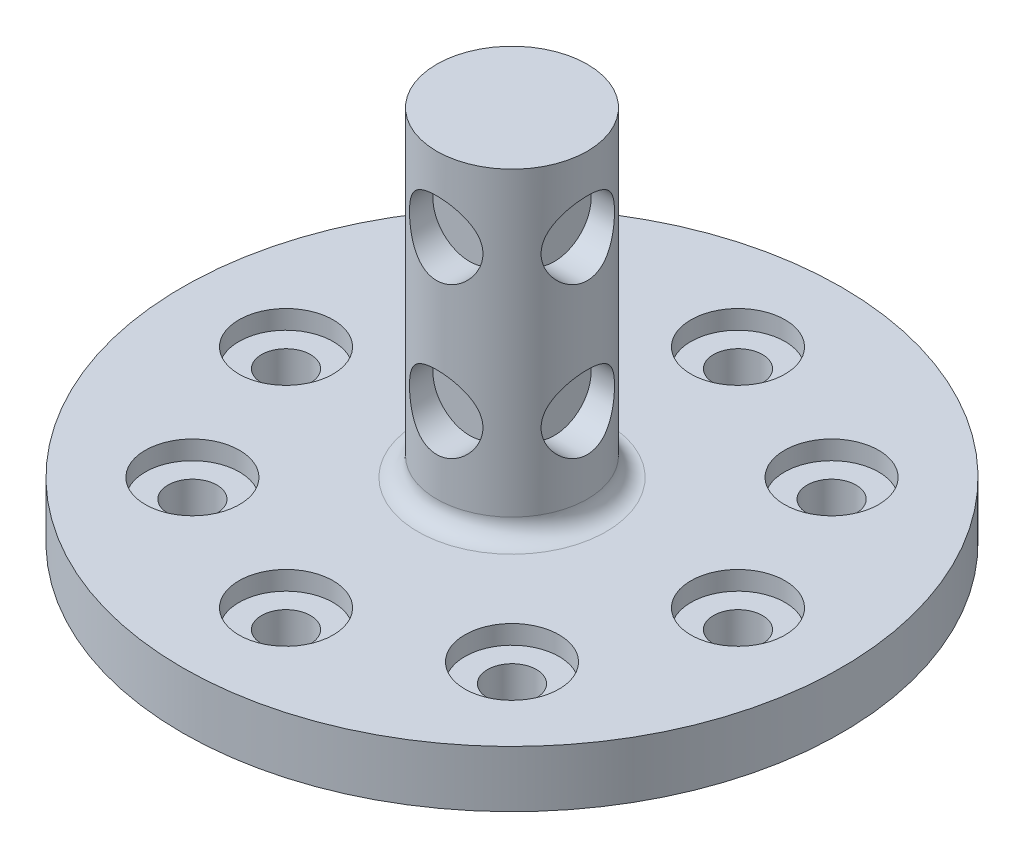
from build123d import *

# Parameters (mm, degrees)
SKETCH_1_R               = 4
EXTRUDE_1_DEPTH          = 16
SKETCH_2_R               = 1.95
CUT_EXTRUDE_1_DEPTH      = 17.970562748
PATTERN_CIRCULAR_1_COUNT = 4
SKETCH_3_W               = 4.5
SKETCH_3_H               = 4.5
EXTRUDE_3_DEPTH          = 16
EXTRUDE_START            = 1
SKETCH_5_R               = 4
EXTRUDE_5_DEPTH          = 1
SKETCH_6_R               = 17.5
EXTRUDE_6_DEPTH          = 3
SKETCH_7_R               = 7.5
CUT_EXTRUDE_2_DEPTH      = 1.8
FILLET_1_R               = 1
SKETCH_8_R               = 1.3
CUT_EXTRUDE_3_DEPTH      = 31.024989649
SKETCH_9_R               = 2.5
SKETCH_9_R_2             = 1.3
CUT_EXTRUDE_4_DEPTH      = 1
PATTERN_CIRCULAR_2_COUNT = 8


with BuildPart() as part:
    # 草图1 → 凸台-拉伸1 (new body)
    with BuildSketch(Plane(origin=(0, 0, 0), x_dir=(1, 0, 0), z_dir=(0, 1, 0))):
        with Locations(Location((0, 0, 0), (0, 0, 270))):
            Circle(SKETCH_1_R)
    extrude(amount=EXTRUDE_1_DEPTH)

    # 草图2 → 切除-拉伸1 (cut, symmetric)
    with BuildSketch(Plane.XY):
        with Locations(Location((0, 12, 0), (0, 0, 90.000000018))):
            Circle(SKETCH_2_R)
        with Locations(Location((0, 4, 0), (0, 0, 90.000000018))):
            Circle(SKETCH_2_R)
    cut_extrude_1 = extrude(amount=CUT_EXTRUDE_1_DEPTH, both=True, mode=Mode.SUBTRACT)

    # 阵列(圆周)1: 切除-拉伸1 ×4 about axis
    pattern_circular_1_axis = Axis((0, 16, 0), (0, 1, 0))
    for i in range(1, PATTERN_CIRCULAR_1_COUNT):
        add(cut_extrude_1.rotate(pattern_circular_1_axis, i * 360 / PATTERN_CIRCULAR_1_COUNT), mode=Mode.SUBTRACT)



with BuildPart() as body_2:
    # 草图3 → 凸台-拉伸3 (new body)
    with BuildSketch(Plane(origin=(0, 16, 0), x_dir=(1, 0, 0), z_dir=(0, 1, 0))):
        Rectangle(SKETCH_3_W, SKETCH_3_H)
    extrude(amount=-EXTRUDE_3_DEPTH)


with BuildPart() as part_1:
    add(part.part)

    add(body_2.part)  # 凸台-拉伸5 merges body 2
    # 草图5 → 凸台-拉伸5 (add)
    with BuildSketch(Plane.XZ.offset(EXTRUDE_START)):
        with Locations(Location((0, 0, 0), (0, 0, 270))):
            Circle(SKETCH_5_R)
    extrude(amount=-EXTRUDE_5_DEPTH)

    # 草图6 → 凸台-拉伸6 (add)
    with BuildSketch(Plane.XZ.offset(1)):
        with Locations(Location((0, 0, 0), (0, 0, 270))):
            Circle(SKETCH_6_R)
    extrude(amount=EXTRUDE_6_DEPTH)

    # 草图7 → 切除-拉伸2 (cut)
    with BuildSketch(Plane.XZ.offset(4)):
        with Locations(Location((0, 0, 0), (0, 0, 270))):
            Circle(SKETCH_7_R)
    extrude(amount=-CUT_EXTRUDE_2_DEPTH, mode=Mode.SUBTRACT)

    # 圆角1
    fillet_1_edges = [part_1.edges().sort_by_distance(p)[0] for p in [
        (0, -1, 4),
    ]]
    fillet(fillet_1_edges, radius=FILLET_1_R - 0.0001)  # a hair under: the kernel refuses the full size

    # 草图8 → 切除-拉伸3 (cut, through all)
    with BuildSketch(Plane(origin=(0, -1, 0), x_dir=(1, 0, 0), z_dir=(0, 1, 0))):
        with Locations(Location((-12, 0, 0), (0, 0, 270))):
            Circle(SKETCH_8_R)
    cut_extrude_3 = extrude(amount=-CUT_EXTRUDE_3_DEPTH, mode=Mode.SUBTRACT)

    # 草图9 → 切除-拉伸4 (cut)
    with BuildSketch(Plane(origin=(0, -1, 0), x_dir=(1, 0, 0), z_dir=(0, 1, 0))):
        with Locations(Location((-12, 0, 0), (0, 0, 270))):
            Circle(SKETCH_9_R)
        with Locations(Location((-12, 0, 0), (0, 0, 270))):
            Circle(SKETCH_9_R_2, mode=Mode.SUBTRACT)
    cut_extrude_4 = extrude(amount=-CUT_EXTRUDE_4_DEPTH, mode=Mode.SUBTRACT)

    # 阵列(圆周)2: 切除-拉伸3, 切除-拉伸4 ×8 about axis
    pattern_circular_2_axis = Axis((0, 0, 0), (0, 1, 0))
    add([cut_extrude_3.rotate(pattern_circular_2_axis, i * 360 / PATTERN_CIRCULAR_2_COUNT) for i in range(1, PATTERN_CIRCULAR_2_COUNT)], mode=Mode.SUBTRACT)
    add([cut_extrude_4.rotate(pattern_circular_2_axis, i * 360 / PATTERN_CIRCULAR_2_COUNT) for i in range(1, PATTERN_CIRCULAR_2_COUNT)], mode=Mode.SUBTRACT)


solid = part_1.part
